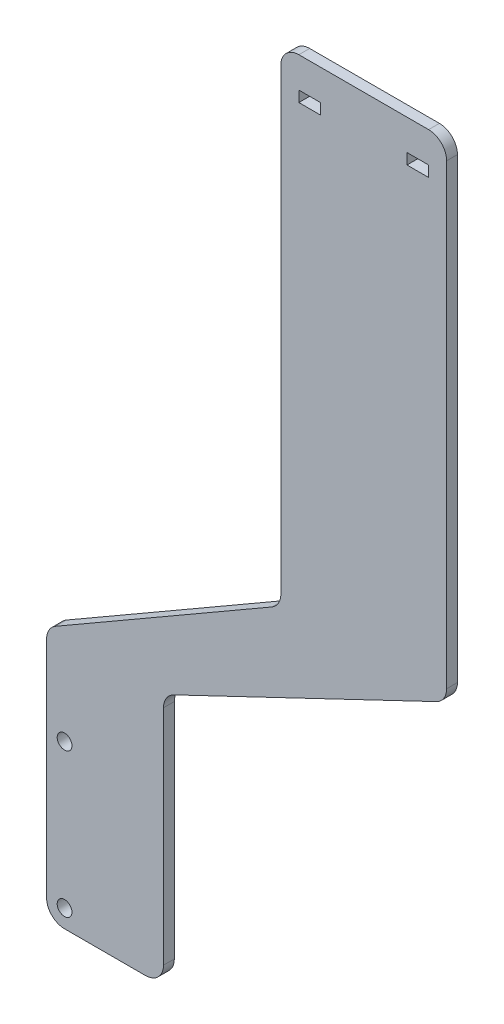
from build123d import *

# Parameters (mm, degrees)
SKETCH1_R           = 2.05
SKETCH1_W           = 6
SKETCH1_H           = 3
BOSS_EXTRUDE1_DEPTH = 3
FILLET1_R           = 5


with BuildPart() as part:
    # Sketch1 → Boss-Extrude1 (new body)
    with BuildSketch(Plane.XY):
        Polygon((-78.603832711, -75.527767497), (-111.052894204, -75.527767497), (-111.052894204, -5.527767497), (-46.052894204, 32), (-46.052894204, 167), (-0.052894204, 167), (-0.052894204, 32), (-78.603832711, -5.527767497), (-78.603832711, -24.956054067), align=None)
        with Locations((-106.052894204, -30.527767497)):
            Circle(SKETCH1_R, mode=Mode.SUBTRACT)
        with Locations((-106.052894204, -70.527767497)):
            Circle(SKETCH1_R, mode=Mode.SUBTRACT)
        with Locations((-38.052894204, 157)):
            Rectangle(SKETCH1_W, SKETCH1_H, mode=Mode.SUBTRACT)
        with Locations((-8.052894204, 157)):
            Rectangle(SKETCH1_W, SKETCH1_H, mode=Mode.SUBTRACT)
    extrude(amount=BOSS_EXTRUDE1_DEPTH)

    # Fillet1
    fillet1_edges = [part.edges().sort_by_distance(p)[0] for p in [
        (-46.052894204, 167, 1.5),
        (-0.052894204, 167, 1.5),
        (-111.052894204, -75.527767497, 1.5),
        (-46.052894204, 32, 1.5),
        (-111.052894204, -5.527767497, 1.5),
        (-78.603832711, -75.527767497, 1.5),
        (-78.603832711, -5.527767497, 1.5),
        (-0.052894204, 32, 1.5),
    ]]
    fillet(fillet1_edges, radius=FILLET1_R)


solid = part.part
